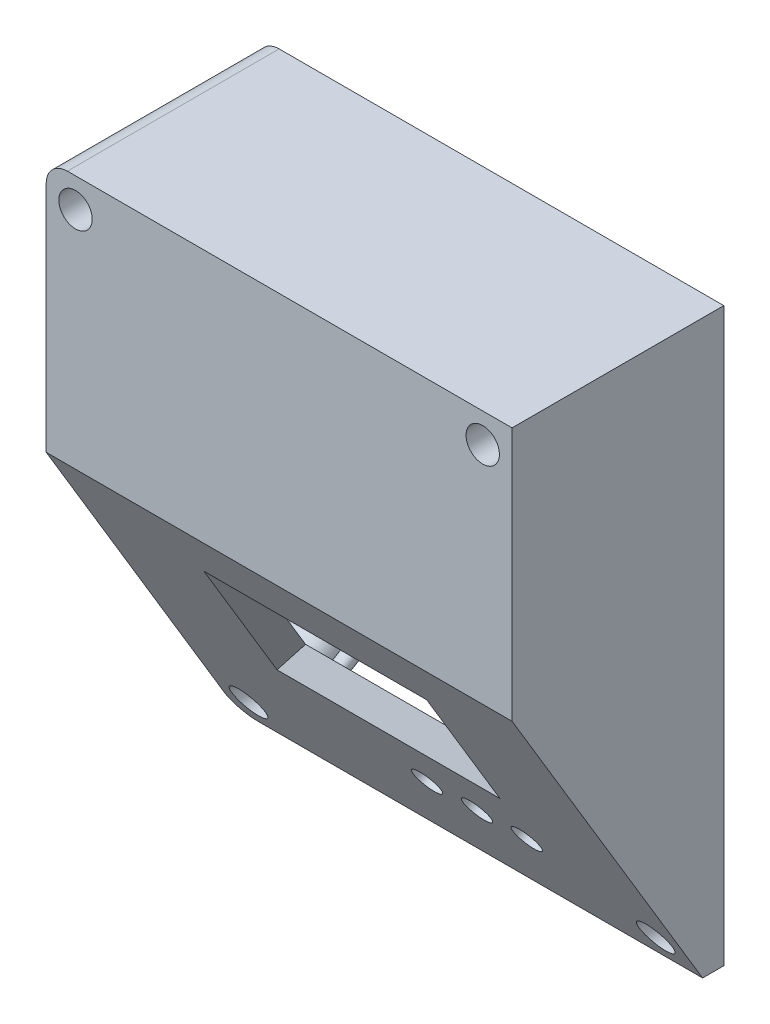
from build123d import *

# Parameters (mm, degrees)
BOSS_EXTRUDE1_DEPTH = 40
CUT_EXTRUDE1_DEPTH  = 88
SHELL1_START        = -88.5
SHELL1_DEPTH        = 80
BOSS_EXTRUDE2_REACH = 116.334
SKETCH3_R           = 4.175
SKETCH3_3_R         = 4.175
BOSS_EXTRUDE3_DEPTH = 40
SKETCH4_R           = 1.575
CUT_EXTRUDE2_DEPTH  = 40
SKETCH4_3_R         = 3.15
SKETCH4_3_R_2       = 1.575
CUT_EXTRUDE3_DEPTH  = 38.5
SKETCH5_R           = 4.675
SKETCH5_R_2         = 2.175
BOSS_EXTRUDE4_DEPTH = 7.5
SKETCH6_W           = 34.1
SKETCH6_H           = 18.9
CUT_EXTRUDE4_DEPTH  = 4
CHAMFER1_SIZE       = 4
SKETCH8_R           = 2.65
CUT_EXTRUDE5_DEPTH  = 4
SKETCH9_R           = 1.4
BOSS_EXTRUDE7_DEPTH = 7.399


# Read off the part's stored shape, not the designer's step: Shell1
with BuildPart() as part:
    # Sketch1 → Boss-Extrude1 (new body)
    with BuildSketch(Plane.XY):
        with BuildLine():
            Line((-4.5, 54), (-88.5, 54))
            ThreePointArc((-88.5, 54), (-91.328427125, 52.828427125), (-92.5, 50))
            Line((-92.5, 50), (-92.5, -50))
            ThreePointArc((-92.5, -50), (-91.328427125, -52.828427125), (-88.5, -54))
            Line((-88.5, -54), (-4.5, -54))
            Line((-4.5, -54), (-4.5, 54))
        make_face()
    extrude(amount=BOSS_EXTRUDE1_DEPTH)

    # Sketch2 → Cut-Extrude1 (cut)
    with BuildSketch(Plane.ZY.offset(92.5)):
        Polygon((6.4, -50), (40, -50), (40, 6), align=None)
        Polygon((4, -54), (40, -54), (40, -50), (6.4, -50), align=None)
    extrude(amount=-CUT_EXTRUDE1_DEPTH, mode=Mode.SUBTRACT)

    # Shell1 outline → Shell1 (cut)
    with BuildSketch(Plane.YZ.offset(SHELL1_START)):
        Polygon((50, 0), (50, 36), (7.10793586, 36), (-50, 1.735238484), (-50, 0), align=None)
    extrude(amount=SHELL1_DEPTH, mode=Mode.SUBTRACT)

    # Boss-Extrude2: up to this plane
    boss_extrude2_end = Plane(origin=(65.471422738, -14.000840508, 23.33473418), z_dir=(0, 0.5144957554275265, -0.8574929257125443))
    # Sketch3 → Boss-Extrude2 (add, up to the surface)
    with BuildSketch(Plane.XY, mode=Mode.PRIVATE) as boss_extrude2_sk1:
        with Locations((-86.962042751, -48.462042751)):
            Circle(SKETCH3_R)
    boss_extrude2_tool1 = split(extrude(boss_extrude2_sk1.sketch, amount=BOSS_EXTRUDE2_REACH, mode=Mode.PRIVATE), bisect_by=boss_extrude2_end, keep=Keep.BOTH, mode=Mode.PRIVATE)
    add(boss_extrude2_tool1.solids().sort_by_distance((-86.962043, -48.462043, 0))[0])
    # Sketch3 → Boss-Extrude2 (add, up to the surface)
    with BuildSketch(Plane.XY, mode=Mode.PRIVATE) as boss_extrude2_sk2:
        with Locations((-10.037957249, -48.462042751)):
            Circle(SKETCH3_R)
    boss_extrude2_tool2 = split(extrude(boss_extrude2_sk2.sketch, amount=BOSS_EXTRUDE2_REACH, mode=Mode.PRIVATE), bisect_by=boss_extrude2_end, keep=Keep.BOTH, mode=Mode.PRIVATE)
    add(boss_extrude2_tool2.solids().sort_by_distance((-10.037957, -48.462043, 0))[0])

    # Sketch3<3> → Boss-Extrude3 (add)
    with BuildSketch(Plane.XY):
        with Locations((-86.962042751, 48.462042751)):
            Circle(SKETCH3_3_R)
        with Locations((-10.037957249, 48.462042751)):
            Circle(SKETCH3_3_R)
    extrude(amount=BOSS_EXTRUDE3_DEPTH)

    # Sketch4 → Cut-Extrude2 (cut)
    with BuildSketch(Plane.XY.offset(40)):
        with Locations((-86.962042751, 48.462042751)):
            Circle(SKETCH4_R)
        with Locations((-10.037957249, 48.462042751)):
            Circle(SKETCH4_R)
        with Locations(Location((-10.037957249, -48.462042751, 0), (0, 0, 90))):
            Circle(SKETCH4_R)
        with Locations(Location((-86.962042751, -48.462042751, 0), (0, 0, 90))):
            Circle(SKETCH4_R)
    extrude(amount=-CUT_EXTRUDE2_DEPTH, mode=Mode.SUBTRACT)

    # Sketch4<3> → Cut-Extrude3 (cut)
    # profile 1 of 4: a face of its own
    with BuildSketch(Plane.XY.offset(40)):
        with Locations((-86.962042751, 48.462042751)):
            Circle(SKETCH4_3_R)
        with Locations(Location((-86.962042751, 48.462042751, 0), (0, 0, 180))):
            Circle(SKETCH4_3_R_2, mode=Mode.SUBTRACT)
    # profile 2 of 4: a face of its own
    with BuildSketch(Plane.XY.offset(40)):
        with Locations((-10.037957249, 48.462042751)):
            Circle(SKETCH4_3_R)
        with Locations(Location((-10.037957249, 48.462042751, 0), (0, 0, 180))):
            Circle(SKETCH4_3_R_2, mode=Mode.SUBTRACT)
    # profile 3 of 4: a face of its own
    with BuildSketch(Plane.XY.offset(40)):
        with Locations(Location((-10.037957249, -48.462042751, 0), (0, 0, 90))):
            Circle(SKETCH4_3_R)
        with Locations(Location((-10.037957249, -48.462042751, 0), (0, 0, 180))):
            Circle(SKETCH4_3_R_2, mode=Mode.SUBTRACT)
    # profile 4 of 4: a face of its own
    with BuildSketch(Plane.XY.offset(40)):
        with Locations(Location((-86.962042751, -48.462042751, 0), (0, 0, 90))):
            Circle(SKETCH4_3_R)
        with Locations(Location((-86.962042751, -48.462042751, 0), (0, 0, 180))):
            Circle(SKETCH4_3_R_2, mode=Mode.SUBTRACT)
    extrude(amount=-CUT_EXTRUDE3_DEPTH, mode=Mode.SUBTRACT)

    # Sketch5 → Boss-Extrude4 (add)
    # profile 1 of 4: a face of its own
    with BuildSketch(Plane(origin=(0, -14.000840508, 23.33473418), x_dir=(-1, 0, 0), z_dir=(0, 0.5144957554275266, -0.8574929257125442))):
        with Locations(Location((79, -30.671229776, 0), (0, 0, 90))):
            Circle(SKETCH5_R)
        with Locations(Location((79, -30.671229776, 0), (0, 0, 90))):
            Circle(SKETCH5_R_2, mode=Mode.SUBTRACT)
    # profile 2 of 4: a face of its own
    with BuildSketch(Plane(origin=(0, -14.000840508, 23.33473418), x_dir=(-1, 0, 0), z_dir=(0, 0.5144957554275266, -0.8574929257125442))):
        with Locations(Location((18, -30.671229776, 0), (0, 0, 90))):
            Circle(SKETCH5_R)
        with Locations(Location((18, -30.671229776, 0), (0, 0, 90))):
            Circle(SKETCH5_R_2, mode=Mode.SUBTRACT)
    # profile 3 of 4: a face of its own
    with BuildSketch(Plane(origin=(0, -14.000840508, 23.33473418), x_dir=(-1, 0, 0), z_dir=(0, 0.5144957554275266, -0.8574929257125442))):
        with Locations(Location((79, 14.328770224, 0), (0, 0, 90))):
            Circle(SKETCH5_R)
        with Locations(Location((79, 14.328770224, 0), (0, 0, 90))):
            Circle(SKETCH5_R_2, mode=Mode.SUBTRACT)
    # profile 4 of 4: a face of its own
    with BuildSketch(Plane(origin=(0, -14.000840508, 23.33473418), x_dir=(-1, 0, 0), z_dir=(0, 0.5144957554275266, -0.8574929257125442))):
        with Locations(Location((18, 14.328770224, 0), (0, 0, 90))):
            Circle(SKETCH5_R)
        with Locations(Location((18, 14.328770224, 0), (0, 0, 90))):
            Circle(SKETCH5_R_2, mode=Mode.SUBTRACT)
    extrude(amount=BOSS_EXTRUDE4_DEPTH)

    # Sketch6 → Cut-Extrude4 (cut)
    with BuildSketch(Plane(origin=(0, -14.000840508, 23.33473418), x_dir=(-1, 0, 0), z_dir=(0, 0.5144957554275266, -0.8574929257125442))):
        with Locations((48.5, -0.994885818)):
            Rectangle(SKETCH6_W, SKETCH6_H)
    extrude(amount=-CUT_EXTRUDE4_DEPTH, mode=Mode.SUBTRACT)

    # Chamfer1
    chamfer1_edges = [part.edges().sort_by_distance(p)[0] for p in [
        (-48.5, -25.015239228, 21.390856463),
        (-31.45, -16.91193108, 26.252841352),
        (-48.5, -8.808622932, 31.114826241),
        (-65.55, -16.91193108, 26.252841352),
    ]]
    chamfer(chamfer1_edges, length=CHAMFER1_SIZE - 0.0001)  # a hair under: the kernel refuses the full size

    # Sketch8 → Cut-Extrude5 (cut)
    with BuildSketch(Plane(origin=(0, -16.058823529, 26.764705882), x_dir=(1, 0, 0), z_dir=(0, -0.5144957554275266, 0.8574929257125442))):
        with Locations(Location((-47.45, -26.521229776, 0), (0, 0, 270))):
            Circle(SKETCH8_R)
        with Locations(Location((-37.95, -26.421229776, 0), (0, 0, 270))):
            Circle(SKETCH8_R)
        with Locations(Location((-28.55, -26.421229776, 0), (0, 0, 270))):
            Circle(SKETCH8_R)
    extrude(amount=-CUT_EXTRUDE5_DEPTH, mode=Mode.SUBTRACT)

    # Sketch9 → Boss-Extrude7 (add)
    with BuildSketch(Plane(origin=(0, -14.000840508, 23.33473418), x_dir=(-1, 0, 0), z_dir=(0, 0.5144957554275266, -0.8574929257125442))):
        with Locations(Location((63, -16.344885818, 0), (0, 0, 270))):
            Circle(SKETCH9_R)
        with Locations(Location((34, -16.344885818, 0), (0, 0, 270))):
            Circle(SKETCH9_R)
        with Locations(Location((34, 10.655114182, 0), (0, 0, 270))):
            Circle(SKETCH9_R)
        with Locations(Location((63, 10.655114182, 0), (0, 0, 270))):
            Circle(SKETCH9_R)
    extrude(amount=BOSS_EXTRUDE7_DEPTH)


solid = part.part
